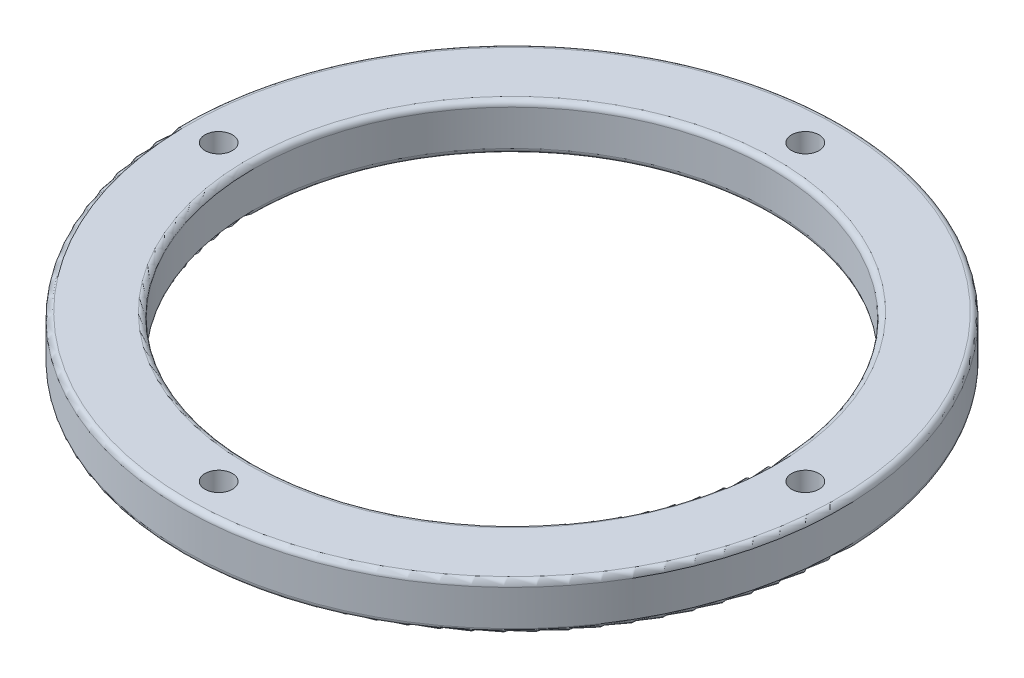
from build123d import *

# Parameters (mm, degrees)
SKETCH1_R           = 60
SKETCH1_R_2         = 47.1
SKETCH1_R_3         = 2.5
BOSS_EXTRUDE1_DEPTH = 8.5
FILLET1_R           = 1


with BuildPart() as part:
    # Sketch1 → Boss-Extrude1 (new body)
    with BuildSketch(Plane(origin=(0, 0, 0), x_dir=(1, 0, 0), z_dir=(0, 1, 0))):
        Circle(SKETCH1_R)
        Circle(SKETCH1_R_2, mode=Mode.SUBTRACT)
        with Locations((0, 53.4)):
            Circle(SKETCH1_R_3, mode=Mode.SUBTRACT)
        with Locations((53.4, 0)):
            Circle(SKETCH1_R_3, mode=Mode.SUBTRACT)
        with Locations((0, -53.4)):
            Circle(SKETCH1_R_3, mode=Mode.SUBTRACT)
        with Locations((-53.4, 0)):
            Circle(SKETCH1_R_3, mode=Mode.SUBTRACT)
    extrude(amount=BOSS_EXTRUDE1_DEPTH)

    # Fillet1
    fillet1_edges = [part.edges().sort_by_distance(p)[0] for p in [
        (-47.1, 0, 0),
        (-47.1, 8.5, 0),
        (-60, 0, 0),
        (-60, 8.5, 0),
    ]]
    fillet(fillet1_edges, radius=FILLET1_R)


solid = part.part
